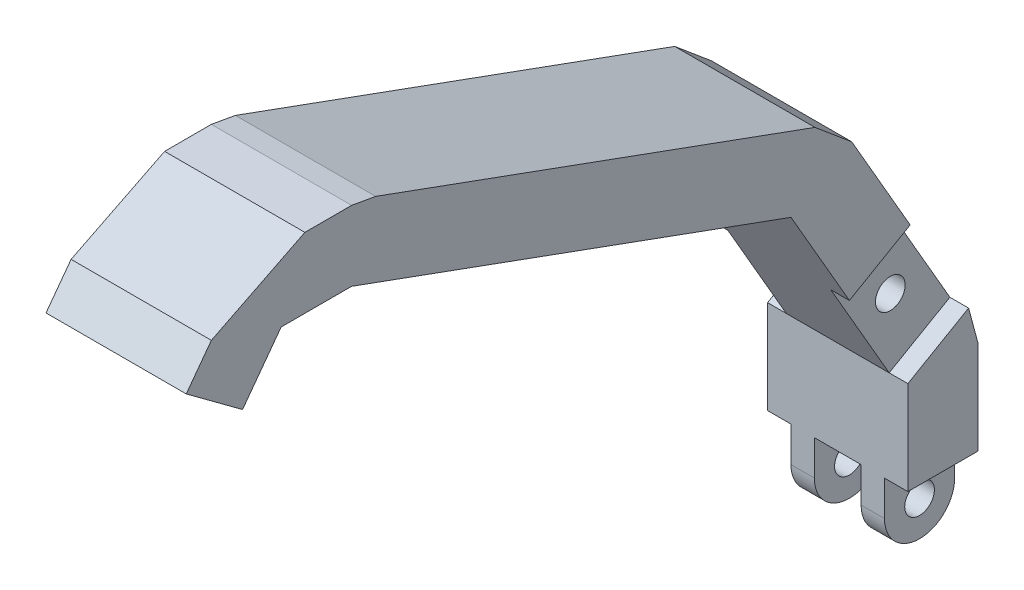
from build123d import *

# Parameters (mm, degrees)
SKETCH2_W                        = 30
SKETCH2_H                        = 15
BOSS_EXTRUDE1_DEPTH              = 10
BOUNDARY1_DEPTH                  = 30
BOSS_EXTRUDE2_DEPTH              = 30
SKETCH4_W                        = 30
SKETCH4_H                        = 15
BOSS_EXTRUDE3_DEPTH              = 100
SKETCH6_W                        = 18
SKETCH6_H                        = 15
BOSS_EXTRUDE4_DEPTH              = 9
BOSS_EXTRUDE5_DEPTH              = 18
CUT_EXTRUDE1_REACH               = 151.344
SKETCH8_R                        = 3
CUT_EXTRUDE2_REACH               = 139.38
SKETCH11_W                       = 30
SKETCH11_H                       = 15
SKETCH12_W                       = 30
SKETCH12_H                       = 15
BOSS_EXTRUDE7_DEPTH              = 50
BOSS_EXTRUDE8_DEPTH              = 30
SKETCH14_W                       = 30
SKETCH14_H                       = 15
BOSS_EXTRUDE10_DEPTH             = 20
BOSS_EXTRUDE11_DEPTH             = 30
SKETCH15_W                       = 5
SKETCH15_H                       = 15
BOSS_EXTRUDE12_DEPTH             = 7.5
SKETCH16_W                       = 5
SKETCH16_H                       = 7.5
REVOLVE1_ANGLE                   = 180
CUT_EXTRUDE3_REACH               = 202.419
SKETCH17_R                       = 3.175
SKETCH18_W                       = 4
SKETCH18_H                       = 25
CUT_EXTRUDE4_DEPTH               = 191.993712728
SKETCH20_R                       = 3.175
CUT_EXTRUDE5_DEPTH               = 201.546523118
SKETCH21_W                       = 30
SKETCH21_H                       = 12
BOSS_EXTRUDE13_DEPTH             = 5
BOSS_EXTRUDE13_DIRECTION_2_REACH = 203.104
SKETCH22_W                       = 30
SKETCH22_H                       = 2.975516747
BOSS_EXTRUDE14_DEPTH             = 5
BOSS_EXTRUDE14_DIRECTION_2_REACH = 203.104


# Read off the part's stored shape, not the designer's step: Boundary1
with BuildPart() as part:
    # Sketch2 → Boss-Extrude1 (new body)
    with BuildSketch(Plane.XY.offset(-30)):
        with Locations((15, 7.5)):
            Rectangle(SKETCH2_W, SKETCH2_H)
    extrude(amount=BOSS_EXTRUDE1_DEPTH)

    # Boundary1 outline → Boundary1 (add)
    with BuildSketch(Plane.YZ):
        Polygon((0, 0), (0, -20), (15, -20), (5, 0), align=None)
    extrude(amount=BOUNDARY1_DEPTH)

    # 3DSketch3 → Boss-Extrude2 (add)
    with BuildSketch(Plane(origin=(0, 15, -30), x_dir=(0, -1, 0), z_dir=(1, 0, 0))):
        Polygon((0, 0), (0.904610688, 5.13030215), (15, 0), align=None)
    extrude(amount=BOSS_EXTRUDE2_DEPTH)

    # Sketch4 → Boss-Extrude3 (add)
    with BuildSketch(Plane(origin=(0, -9.641814145, -26.490666647), x_dir=(1, 0, 0), z_dir=(0, 0.34202014332566943, 0.9396926207859081))):
        with Locations((15, 17.7606043)):
            Rectangle(SKETCH4_W, SKETCH4_H)
    extrude(amount=-BOSS_EXTRUDE3_DEPTH)

    # Sketch6 → Boss-Extrude4 (add)
    with BuildSketch(Plane(origin=(0, -43.843828478, -120.459928725), x_dir=(-1, 0, 0), z_dir=(0, -0.3420201433256693, -0.9396926207859083))):
        with Locations((-15, 17.7606043)):
            Rectangle(SKETCH6_W, SKETCH6_H)
    extrude(amount=BOSS_EXTRUDE4_DEPTH)

    # Sketch7 → Boss-Extrude5 (add)
    with BuildSketch(Plane.ZY.offset(-6)):
        with BuildLine():
            Line((-137.556797816, -23.184806311), (-132.426495666, -37.280195622))
            ThreePointArc((-132.426495666, -37.280195622), (-142.039341397, -32.797652042), (-137.556797816, -23.184806311))
        make_face()
    extrude(amount=-BOSS_EXTRUDE5_DEPTH)

    # Sketch8 → Cut-Extrude1 (cut, up to next)
    with BuildSketch(Plane.ZY.offset(-6), mode=Mode.PRIVATE) as cut_extrude1_sk1:
        with Locations((-134.991646741, -30.232500967)):
            Circle(SKETCH8_R)
    cut_extrude1_tool1 = extrude(cut_extrude1_sk1.sketch, amount=-CUT_EXTRUDE1_REACH, mode=Mode.PRIVATE) & part.part
    add(cut_extrude1_tool1.solids().sort_by_distance((6, -30.232501, -134.991647))[0], mode=Mode.SUBTRACT)

    # Sketch11 → Cut-Extrude2 (cut, up to next)
    with BuildSketch(Plane(origin=(0, -43.843828478, -120.459928725), x_dir=(-1, 0, 0), z_dir=(0, -0.3420201433256693, -0.9396926207859083)), mode=Mode.PRIVATE) as cut_extrude2_sk1:
        with Locations((-15, 17.7606043)):
            Rectangle(SKETCH11_W, SKETCH11_H)
    cut_extrude2_tool1 = extrude(cut_extrude2_sk1.sketch, amount=CUT_EXTRUDE2_REACH, mode=Mode.PRIVATE) & part.part
    add(cut_extrude2_tool1.solids().sort_by_distance((15, -27.15432, -126.534413))[0], mode=Mode.SUBTRACT)



with BuildPart() as body_2:
    # Sketch12 → Boss-Extrude7 (new body)
    with BuildSketch(Plane(origin=(0, -79.331775874, -45.802222156), x_dir=(1, 0, 0), z_dir=(0, -0.8660254037844397, -0.49999999999999833))):
        with Locations((15, -97.759523082)):
            Rectangle(SKETCH12_W, SKETCH12_H)
    extrude(amount=BOSS_EXTRUDE7_DEPTH)


with BuildPart() as part_1:
    add(part.part)

    add(body_2.part)  # Boss-Extrude8 merges body 2
    # 3DSketch4 → Boss-Extrude8 (add)
    with BuildSketch(Plane(origin=(0, -20.106625021, -129.099564228), x_dir=(0, -0.9396926207859082, 0.3420201433256692), z_dir=(1, 0, 0))):
        Polygon((0, 0), (3.509333353, 9.641814145), (15, 0), align=None)
    extrude(amount=BOSS_EXTRUDE8_DEPTH)



with BuildPart() as body_2_2:
    # Sketch14 → Boss-Extrude10 (new body)
    with BuildSketch(Plane(origin=(0, -77.503284522, 0), x_dir=(-1, 0, 0), z_dir=(0, -1, 0))):
        with Locations((-15, 156.469262079)):
            Rectangle(SKETCH14_W, SKETCH14_H)
    extrude(amount=BOSS_EXTRUDE10_DEPTH)


with BuildPart() as part_2:
    add(part_1.part)

    add(body_2_2.part)  # Boss-Extrude11 merges body 2 2
    # 3DSketch5 → Boss-Extrude11 (add)
    with BuildSketch(Plane(origin=(0, -77.503284522, -163.969262079), x_dir=(0, 0, 1), z_dir=(-1, 0, 0))):
        Polygon((0, 0), (15, 0), (2.009618943, 7.5), align=None)
    extrude(amount=-BOSS_EXTRUDE11_DEPTH)

    # Sketch15 → Boss-Extrude12 (add)
    with BuildSketch(Plane.XZ.offset(97.503284522)):
        with Locations((7.5, -156.469262079)):
            Rectangle(SKETCH15_W, SKETCH15_H)
        with Locations((22.5, -156.469262079)):
            Rectangle(SKETCH15_W, SKETCH15_H)
    extrude(amount=BOSS_EXTRUDE12_DEPTH)

    # Sketch16 → Revolve1 (revolve)
    with BuildSketch(Plane.XZ.offset(105.003284522)):
        with Locations((22.5, -160.219262079)):
            Rectangle(SKETCH16_W, SKETCH16_H)
        with Locations((7.5, -160.219262079)):
            Rectangle(SKETCH16_W, SKETCH16_H)
    revolve(axis=Axis((25, -105.003284522, -156.469262079), (-1, 0, 0)), revolution_arc=REVOLVE1_ANGLE)

    # Cut-Extrude3: up to this face of the body (flat: up to its plane)
    cut_extrude3_end = Plane(part_2.part.faces().sort_by_distance((25, -104.30316058, -156.469262079))[0])
    # Sketch17 → Cut-Extrude3 (cut, up to the picked face)
    with BuildSketch(Plane.ZY.offset(-5), mode=Mode.PRIVATE) as cut_extrude3_sk1:
        with Locations((-156.469262079, -105.003284522)):
            Circle(SKETCH17_R)
    cut_extrude3_tool1 = split(extrude(cut_extrude3_sk1.sketch, amount=-CUT_EXTRUDE3_REACH, mode=Mode.PRIVATE), bisect_by=cut_extrude3_end, keep=Keep.BOTH, mode=Mode.PRIVATE)
    add(cut_extrude3_tool1.solids().sort_by(Axis((5, -105.003285, -156.469262), (1, 0, 0)))[0], mode=Mode.SUBTRACT)

    # Sketch18 → Cut-Extrude4 (cut, through all)
    with BuildSketch(Plane(origin=(0, 52.629761541, -91.157420979), x_dir=(-1, 0, 0), z_dir=(0, 0.4999999999999983, -0.8660254037844398))):
        with Locations((-2, -129.104444312)):
            Rectangle(SKETCH18_W, SKETCH18_H)
        with Locations((-28, -129.104444312)):
            Rectangle(SKETCH18_W, SKETCH18_H)
    extrude(amount=-CUT_EXTRUDE4_DEPTH, mode=Mode.SUBTRACT)

    # Sketch20 → Cut-Extrude5 (cut, through all)
    with BuildSketch(Plane.ZY.offset(-4)):
        with Locations((-149.214452607, -62.927966974)):
            Circle(SKETCH20_R)
    extrude(amount=-CUT_EXTRUDE5_DEPTH, mode=Mode.SUBTRACT)

    # Sketch21 → Boss-Extrude13 (add)
    with BuildSketch(Plane(origin=(0, 0, 0), x_dir=(-1, 0, 0), z_dir=(0, -0.8036491793257791, 0.5951033494856183))):
        with Locations((-15, 6)):
            Rectangle(SKETCH21_W, SKETCH21_H)
    extrude(amount=BOSS_EXTRUDE13_DEPTH)

    # Sketch21 → Boss-Extrude13 direction 2 (add, up to next)
    with BuildSketch(Plane(origin=(0, 0, 0), x_dir=(-1, 0, 0), z_dir=(0, -0.8036491793257791, 0.5951033494856183)), mode=Mode.PRIVATE) as boss_extrude13_direction_2_sk1:
        with Locations((-15, 6)):
            Rectangle(SKETCH21_W, SKETCH21_H)
    boss_extrude13_direction_2_tool1 = extrude(boss_extrude13_direction_2_sk1.sketch, amount=-BOSS_EXTRUDE13_DIRECTION_2_REACH, mode=Mode.PRIVATE) - part_2.part
    add(boss_extrude13_direction_2_tool1.solids().sort_by_distance((15, -3.57062, -4.821895))[0])

    # Sketch22 → Boss-Extrude14 (add)
    with BuildSketch(Plane(origin=(0, 0, 0), x_dir=(-1, 0, 0), z_dir=(0, -0.8036491793257791, 0.5951033494856183))):
        with Locations((-15, -1.487758374)):
            Rectangle(SKETCH22_W, SKETCH22_H)
    extrude(amount=BOSS_EXTRUDE14_DEPTH)

    # Boss-Extrude14 direction 2: up to this plane
    boss_extrude14_direction_2_end = Plane(origin=(0, 5, 0), z_dir=(0, 0.894427190999916, 0.447213595499958))
    # Sketch22 → Boss-Extrude14 direction 2 (add, up to the surface)
    with BuildSketch(Plane(origin=(0, 0, 0), x_dir=(-1, 0, 0), z_dir=(0, -0.8036491793257791, 0.5951033494856183)), mode=Mode.PRIVATE) as boss_extrude14_direction_2_sk1:
        with Locations((-15, -1.487758374)):
            Rectangle(SKETCH22_W, SKETCH22_H)
    boss_extrude14_direction_2_tool1 = split(extrude(boss_extrude14_direction_2_sk1.sketch, amount=-BOSS_EXTRUDE14_DIRECTION_2_REACH, mode=Mode.PRIVATE), bisect_by=boss_extrude14_direction_2_end, keep=Keep.BOTH, mode=Mode.PRIVATE)
    add(boss_extrude14_direction_2_tool1.solids().sort_by_distance((15, 0.88537, 1.195636))[0])


solid = part_2.part
